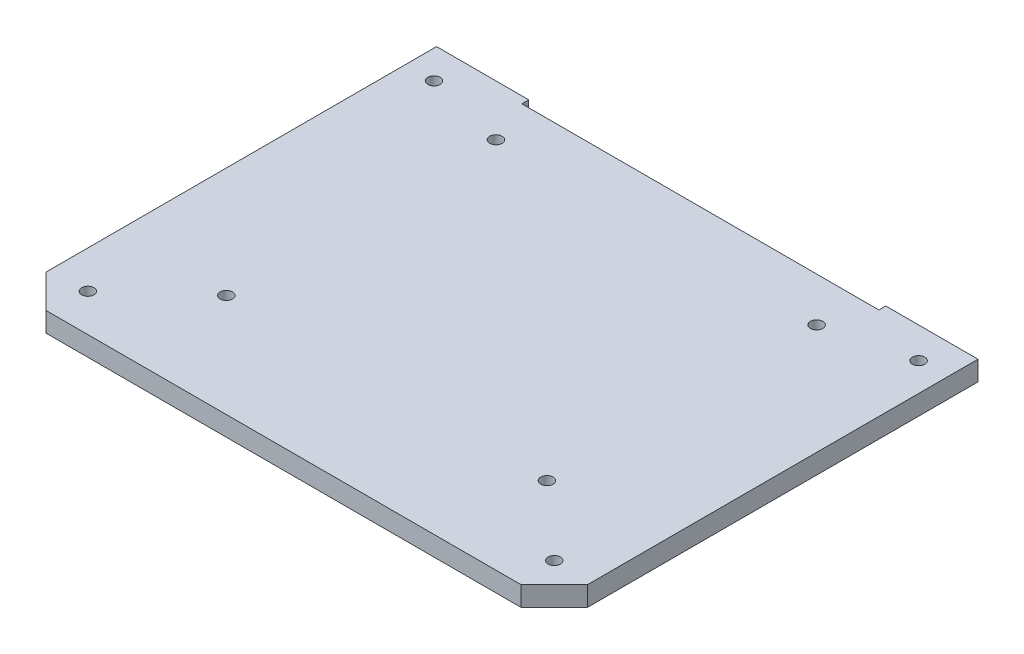
from build123d import *

# Parameters (mm, degrees)
LID_PLATE_DEPTH     = 2.4
DRIP_SKIRT_DEPTH    = 3.01
SKETCH3_W           = 25.3
SKETCH3_H           = 1.9
FRONT_SKIRT_L_DEPTH = 5.4
SKETCH4_W           = 25.3
SKETCH4_H           = 1.9
FRONT_SKIRT_R_DEPTH = 5.4
SKETCH5_R           = 1.7
SCREW_HOLES_DEPTH   = 4.4


with BuildPart() as part:
    # Sketch1 → Lid Plate (new body)
    with BuildSketch(Plane(origin=(0, 28, 0), x_dir=(1, 0, 0), z_dir=(0, 1, 0))):
        Polygon((-65.187005769, -126.3), (65.187005769, -126.3), (74.3, -117.187005769), (74.3, -11.9), (-74.3, -11.9), (-74.3, -117.187005769), align=None)
    extrude(amount=LID_PLATE_DEPTH)

    # Sketch2 → Drip Skirt (add)
    with BuildSketch(Plane(origin=(0, 25, 0), x_dir=(1, 0, 0), z_dir=(0, 1, 0))):
        Polygon((74.3, -11.9), (74.3, -117.187005769), (65.187005769, -126.3), (-65.187005769, -126.3), (-74.3, -117.187005769), (-74.3, -11.9), (-72.7, -11.9), (-72.7, -116.524264069), (-64.524264069, -124.7), (64.524264069, -124.7), (72.7, -116.524264069), (72.7, -11.9), align=None)
    extrude(amount=DRIP_SKIRT_DEPTH)

    # Sketch3 → Front Skirt L (add)
    with BuildSketch(Plane(origin=(0, 25, 0), x_dir=(1, 0, 0), z_dir=(0, 1, 0))):
        with Locations((-61.65, -10.95)):
            Rectangle(SKETCH3_W, SKETCH3_H)
    extrude(amount=FRONT_SKIRT_L_DEPTH)

    # Sketch4 → Front Skirt R (add)
    with BuildSketch(Plane(origin=(0, 25, 0), x_dir=(1, 0, 0), z_dir=(0, 1, 0))):
        with Locations((61.65, -10.95)):
            Rectangle(SKETCH4_W, SKETCH4_H)
    extrude(amount=FRONT_SKIRT_R_DEPTH)

    # Sketch5 → Screw Holes (cut)
    with BuildSketch(Plane(origin=(0, 27, 0), x_dir=(1, 0, 0), z_dir=(0, 1, 0))):
        with Locations((-66.5, -18.5)):
            Circle(SKETCH5_R)
        with Locations((66.5, -18.5)):
            Circle(SKETCH5_R)
        with Locations((-64, -116)):
            Circle(SKETCH5_R)
        with Locations((64, -116)):
            Circle(SKETCH5_R)
        with Locations((-44, -24)):
            Circle(SKETCH5_R)
        with Locations((-44, -98)):
            Circle(SKETCH5_R)
        with Locations((44, -24)):
            Circle(SKETCH5_R)
        with Locations((44, -98)):
            Circle(SKETCH5_R)
    extrude(amount=SCREW_HOLES_DEPTH, mode=Mode.SUBTRACT)


solid = part.part
